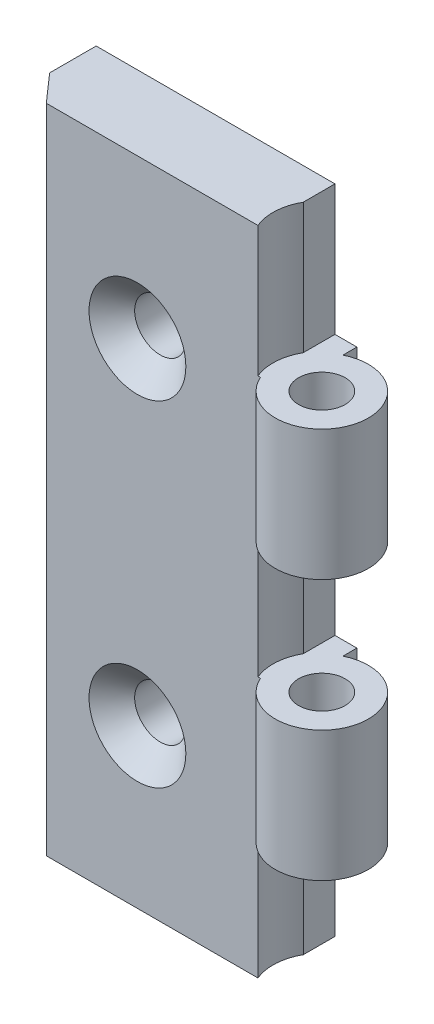
from build123d import *

# Parameters (mm, degrees)
SKETCH1_R                                       = 2.5
BOSS_EXTRUDE1_DEPTH                             = 35
CUT_EXTRUDE1_OUTLINE_W                          = 11.354248689
CUT_EXTRUDE1_OUTLINE_H                          = 14
CUT_EXTRUDE1_DEPTH                              = 10.980294351
CSK_FOR_M5_FLAT_HEAD_MACHINE_SCREW1_D           = 5.5
CSK_FOR_M5_FLAT_HEAD_MACHINE_SCREW1_DEPTH       = 13.347633298
CSK_FOR_M5_FLAT_HEAD_MACHINE_SCREW1_CSINK_D     = 10.4
CSK_FOR_M5_FLAT_HEAD_MACHINE_SCREW1_CSINK_ANGLE = 90
CSK_FOR_M5_FLAT_HEAD_MACHINE_SCREW1_TIP         = 1.652366702
SKETCH6_R                                       = 5.25
CUT_EXTRUDE2_DEPTH                              = 14
CUT_EXTRUDE3_START                              = -28
SKETCH6_2_R                                     = 5.25
CUT_EXTRUDE3_DEPTH                              = 14
CUT_EXTRUDE4_START                              = -56
SKETCH6_3_R                                     = 5.25
CUT_EXTRUDE4_DEPTH                              = 14


# Read off the part's stored shape, not the designer's step: Cut-Extrude1
with BuildPart() as part:
    # Sketch1 → Boss-Extrude1 (new, symmetric)
    with BuildSketch(Plane(origin=(0, 0, 0), x_dir=(1, 0, 0), z_dir=(0, 1, 0))):
        with BuildLine():
            Line((0, 0), (28, 0))
            Line((28, 0), (28, -1.5))
            ThreePointArc((28, -1.5), (34.920820135, -7.683011565), (25.645751311, -8))
            Line((25.645751311, -8), (2.645751311, -8))
            Line((2.645751311, -8), (0, -5))
            Line((0, -5), (0, 0))
        make_face()
        with Locations(Location((30.219676222, -5.980294351, 0), (0, 0, 270))):
            Circle(SKETCH1_R, mode=Mode.SUBTRACT)
    extrude(amount=BOSS_EXTRUDE1_DEPTH, both=True)

    # Cut-Extrude1 outline → Cut-Extrude1 (cut)
    with BuildSketch(Plane.XY):
        with Locations((31.322875655, 0)):
            Rectangle(CUT_EXTRUDE1_OUTLINE_W, CUT_EXTRUDE1_OUTLINE_H)
        with Locations((31.322875655, 28)):
            Rectangle(CUT_EXTRUDE1_OUTLINE_W, CUT_EXTRUDE1_OUTLINE_H)
        with Locations((31.322875655, -28)):
            Rectangle(CUT_EXTRUDE1_OUTLINE_W, CUT_EXTRUDE1_OUTLINE_H)
    extrude(amount=CUT_EXTRUDE1_DEPTH, mode=Mode.SUBTRACT)

    # CSK for M5 Flat Head Machine Screw1
    with Locations(Plane.XY.offset(8)):
        with Locations((12.432713767, 18), (12.432713767, -18)):
            CounterSinkHole(CSK_FOR_M5_FLAT_HEAD_MACHINE_SCREW1_D / 2, CSK_FOR_M5_FLAT_HEAD_MACHINE_SCREW1_CSINK_D / 2, depth=CSK_FOR_M5_FLAT_HEAD_MACHINE_SCREW1_DEPTH, counter_sink_angle=CSK_FOR_M5_FLAT_HEAD_MACHINE_SCREW1_CSINK_ANGLE)
            with Locations((0, 0, -(CSK_FOR_M5_FLAT_HEAD_MACHINE_SCREW1_DEPTH + CSK_FOR_M5_FLAT_HEAD_MACHINE_SCREW1_TIP / 2))):  # 118° drill point
                Cone(0, CSK_FOR_M5_FLAT_HEAD_MACHINE_SCREW1_D / 2, CSK_FOR_M5_FLAT_HEAD_MACHINE_SCREW1_TIP, mode=Mode.SUBTRACT)

    # Sketch6 → Cut-Extrude2 (cut)
    with BuildSketch(Plane(origin=(0, 35, 0), x_dir=(1, 0, 0), z_dir=(0, 1, 0))):
        with Locations((30.219676222, -5.980294351)):
            Circle(SKETCH6_R)
    extrude(amount=-CUT_EXTRUDE2_DEPTH, mode=Mode.SUBTRACT)

    # Sketch6<2> → Cut-Extrude3 (cut)
    with BuildSketch(Plane(origin=(0, 35, 0), x_dir=(1, 0, 0), z_dir=(0, 1, 0)).offset(CUT_EXTRUDE3_START)):
        with Locations((30.219676222, -5.980294351)):
            Circle(SKETCH6_2_R)
    extrude(amount=-CUT_EXTRUDE3_DEPTH, mode=Mode.SUBTRACT)

    # Sketch6<3> → Cut-Extrude4 (cut)
    with BuildSketch(Plane(origin=(0, 35, 0), x_dir=(1, 0, 0), z_dir=(0, 1, 0)).offset(CUT_EXTRUDE4_START)):
        with Locations((30.219676222, -5.980294351)):
            Circle(SKETCH6_3_R)
    extrude(amount=-CUT_EXTRUDE4_DEPTH, mode=Mode.SUBTRACT)


solid = part.part
